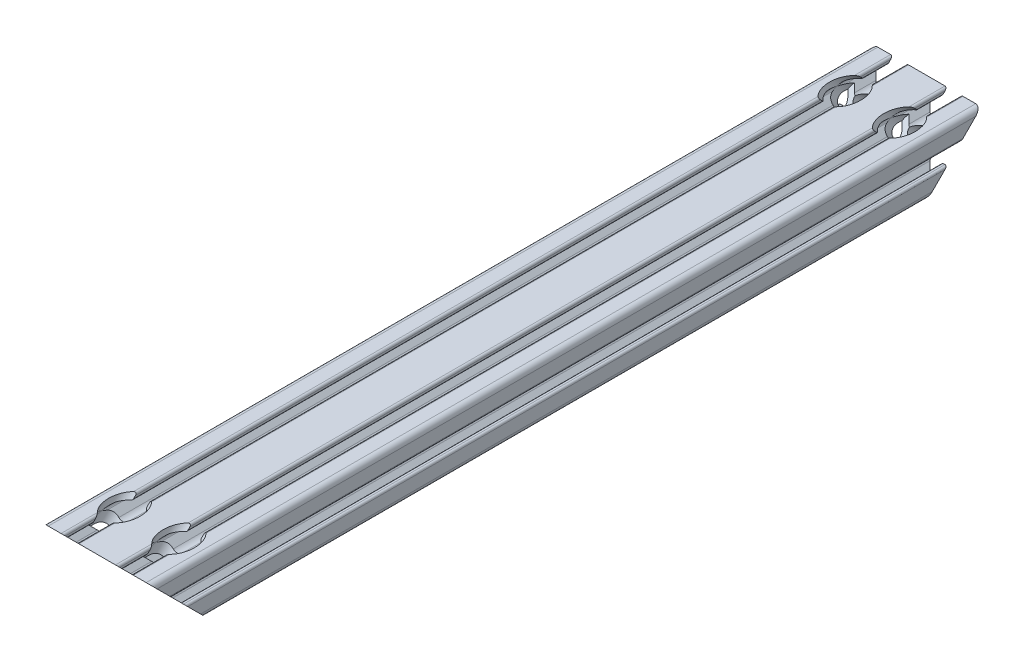
from build123d import *

# Parameters (mm, degrees)
SKETCH1_R               = 2.1463
BOSS_EXTRUDE1_DEPTH     = 152.4
CUT_EXTRUDE1_DEPTH      = 155.030029962
CUT_EXTRUDE1_DEPTH_BACK = 155.030029962


with BuildPart() as part:
    # Sketch1 → Boss-Extrude1 (new, symmetric)
    with BuildSketch(Plane.XY):
        with BuildLine():
            Line((-19.9898, 7.9883), (-19.9898, 3.2893))
            ThreePointArc((-19.9898, 3.2893), (-19.75917588, 2.73252412), (-19.2024, 2.5019))
            Line((-19.2024, 2.5019), (-18.4912, 2.5019))
            ThreePointArc((-18.4912, 2.5019), (-18.275673853, 2.591173853), (-18.1864, 2.8067))
            Line((-18.1864, 2.8067), (-18.1864, 4.9149))
            ThreePointArc((-18.1864, 4.9149), (-17.668965253, 5.689295824), (-16.755503096, 5.507596904))
            Line((-16.755503096, 5.507596904), (-14.500665747, 3.252759555))
            ThreePointArc((-14.500665747, 3.252759555), (-13.850954457, 2.280397894), (-13.622806192, 1.133419111))
            Line((-13.622806192, 1.133419111), (-13.622806192, -1.133419111))
            ThreePointArc((-13.622806192, -1.133419111), (-13.850954457, -2.280397894), (-14.500665747, -3.252759555))
            Line((-14.500665747, -3.252759555), (-16.755503096, -5.507596904))
            ThreePointArc((-16.755503096, -5.507596904), (-17.668965253, -5.689295824), (-18.1864, -4.9149))
            Line((-18.1864, -4.9149), (-18.1864, -2.8067))
            ThreePointArc((-18.1864, -2.8067), (-18.275673853, -2.591173853), (-18.4912, -2.5019))
            Line((-18.4912, -2.5019), (-19.2024, -2.5019))
            ThreePointArc((-19.2024, -2.5019), (-19.75917588, -2.73252412), (-19.9898, -3.2893))
            Line((-19.9898, -3.2893), (-19.9898, -7.9883))
            ThreePointArc((-19.9898, -7.9883), (-19.402080467, -9.407180467), (-17.9832, -9.9949))
            Line((-17.9832, -9.9949), (-13.2842, -9.9949))
            ThreePointArc((-13.2842, -9.9949), (-12.72742412, -9.76427588), (-12.4968, -9.2075))
            Line((-12.4968, -9.2075), (-12.4968, -8.4963))
            ThreePointArc((-12.4968, -8.4963), (-12.586073853, -8.280773853), (-12.8016, -8.1915))
            Line((-12.8016, -8.1915), (-14.9098, -8.1915))
            ThreePointArc((-14.9098, -8.1915), (-15.684195824, -7.674065253), (-15.502496904, -6.760603096))
            Line((-15.502496904, -6.760603096), (-13.247659555, -4.505765747))
            ThreePointArc((-13.247659555, -4.505765747), (-12.275297894, -3.856054457), (-11.128319111, -3.627906192))
            Line((-11.128319111, -3.627906192), (-8.861480889, -3.627906192))
            ThreePointArc((-8.861480889, -3.627906192), (-7.714502106, -3.856054457), (-6.742140445, -4.505765747))
            Line((-6.742140445, -4.505765747), (-4.487303096, -6.760603096))
            ThreePointArc((-4.487303096, -6.760603096), (-4.305604176, -7.674065253), (-5.08, -8.1915))
            Line((-5.08, -8.1915), (-7.1882, -8.1915))
            ThreePointArc((-7.1882, -8.1915), (-7.403726147, -8.280773853), (-7.493, -8.4963))
            Line((-7.493, -8.4963), (-7.493, -9.2075))
            ThreePointArc((-7.493, -9.2075), (-7.26237588, -9.76427588), (-6.7056, -9.9949))
            Line((-6.7056, -9.9949), (0, -9.9949))
            Line((0, -9.9949), (6.7056, -9.9949))
            ThreePointArc((6.7056, -9.9949), (7.26237588, -9.76427588), (7.493, -9.2075))
            Line((7.493, -9.2075), (7.493, -8.4963))
            ThreePointArc((7.493, -8.4963), (7.403726147, -8.280773853), (7.1882, -8.1915))
            Line((7.1882, -8.1915), (5.08, -8.1915))
            ThreePointArc((5.08, -8.1915), (4.305604176, -7.674065253), (4.487303096, -6.760603096))
            Line((4.487303096, -6.760603096), (6.742140445, -4.505765747))
            ThreePointArc((6.742140445, -4.505765747), (7.714502106, -3.856054457), (8.861480889, -3.627906192))
            Line((8.861480889, -3.627906192), (11.128319111, -3.627906192))
            ThreePointArc((11.128319111, -3.627906192), (12.275297894, -3.856054457), (13.247659555, -4.505765747))
            Line((13.247659555, -4.505765747), (15.502496904, -6.760603096))
            ThreePointArc((15.502496904, -6.760603096), (15.684195824, -7.674065253), (14.9098, -8.1915))
            Line((14.9098, -8.1915), (12.8016, -8.1915))
            ThreePointArc((12.8016, -8.1915), (12.586073853, -8.280773853), (12.4968, -8.4963))
            Line((12.4968, -8.4963), (12.4968, -9.2075))
            ThreePointArc((12.4968, -9.2075), (12.72742412, -9.76427588), (13.2842, -9.9949))
            Line((13.2842, -9.9949), (17.9832, -9.9949))
            ThreePointArc((17.9832, -9.9949), (19.402080467, -9.407180467), (19.9898, -7.9883))
            Line((19.9898, -7.9883), (19.9898, -3.2893))
            ThreePointArc((19.9898, -3.2893), (19.75917588, -2.73252412), (19.2024, -2.5019))
            Line((19.2024, -2.5019), (18.4912, -2.5019))
            ThreePointArc((18.4912, -2.5019), (18.275673853, -2.591173853), (18.1864, -2.8067))
            Line((18.1864, -2.8067), (18.1864, -4.9149))
            ThreePointArc((18.1864, -4.9149), (17.668965253, -5.689295824), (16.755503096, -5.507596904))
            Line((16.755503096, -5.507596904), (14.500665747, -3.252759555))
            ThreePointArc((14.500665747, -3.252759555), (13.850954457, -2.280397894), (13.622806192, -1.133419111))
            Line((13.622806192, -1.133419111), (13.622806192, 1.133419111))
            ThreePointArc((13.622806192, 1.133419111), (13.850954457, 2.280397894), (14.500665747, 3.252759555))
            Line((14.500665747, 3.252759555), (16.755503096, 5.507596904))
            ThreePointArc((16.755503096, 5.507596904), (17.668965253, 5.689295824), (18.1864, 4.9149))
            Line((18.1864, 4.9149), (18.1864, 2.8067))
            ThreePointArc((18.1864, 2.8067), (18.275673853, 2.591173853), (18.4912, 2.5019))
            Line((18.4912, 2.5019), (19.2024, 2.5019))
            ThreePointArc((19.2024, 2.5019), (19.75917588, 2.73252412), (19.9898, 3.2893))
            Line((19.9898, 3.2893), (19.9898, 7.9883))
            ThreePointArc((19.9898, 7.9883), (19.402080467, 9.407180467), (17.9832, 9.9949))
            Line((17.9832, 9.9949), (13.2842, 9.9949))
            ThreePointArc((13.2842, 9.9949), (12.72742412, 9.76427588), (12.4968, 9.2075))
            Line((12.4968, 9.2075), (12.4968, 8.4963))
            ThreePointArc((12.4968, 8.4963), (12.586073853, 8.280773853), (12.8016, 8.1915))
            Line((12.8016, 8.1915), (14.9098, 8.1915))
            ThreePointArc((14.9098, 8.1915), (15.684195824, 7.674065253), (15.502496904, 6.760603096))
            Line((15.502496904, 6.760603096), (13.247659555, 4.505765747))
            ThreePointArc((13.247659555, 4.505765747), (12.275297894, 3.856054457), (11.128319111, 3.627906192))
            Line((11.128319111, 3.627906192), (8.861480889, 3.627906192))
            ThreePointArc((8.861480889, 3.627906192), (7.714502106, 3.856054457), (6.742140445, 4.505765747))
            Line((6.742140445, 4.505765747), (4.487303096, 6.760603096))
            ThreePointArc((4.487303096, 6.760603096), (4.305604176, 7.674065253), (5.08, 8.1915))
            Line((5.08, 8.1915), (7.1882, 8.1915))
            ThreePointArc((7.1882, 8.1915), (7.403726147, 8.280773853), (7.493, 8.4963))
            Line((7.493, 8.4963), (7.493, 9.2075))
            ThreePointArc((7.493, 9.2075), (7.26237588, 9.76427588), (6.7056, 9.9949))
            Line((6.7056, 9.9949), (0, 9.9949))
            Line((0, 9.9949), (-6.7056, 9.9949))
            ThreePointArc((-6.7056, 9.9949), (-7.26237588, 9.76427588), (-7.493, 9.2075))
            Line((-7.493, 9.2075), (-7.493, 8.4963))
            ThreePointArc((-7.493, 8.4963), (-7.403726147, 8.280773853), (-7.1882, 8.1915))
            Line((-7.1882, 8.1915), (-5.08, 8.1915))
            ThreePointArc((-5.08, 8.1915), (-4.305604176, 7.674065253), (-4.487303096, 6.760603096))
            Line((-4.487303096, 6.760603096), (-6.742140445, 4.505765747))
            ThreePointArc((-6.742140445, 4.505765747), (-7.714502106, 3.856054457), (-8.861480889, 3.627906192))
            Line((-8.861480889, 3.627906192), (-11.128319111, 3.627906192))
            ThreePointArc((-11.128319111, 3.627906192), (-12.275297894, 3.856054457), (-13.247659555, 4.505765747))
            Line((-13.247659555, 4.505765747), (-15.502496904, 6.760603096))
            ThreePointArc((-15.502496904, 6.760603096), (-15.684195824, 7.674065253), (-14.9098, 8.1915))
            Line((-14.9098, 8.1915), (-12.8016, 8.1915))
            ThreePointArc((-12.8016, 8.1915), (-12.586073853, 8.280773853), (-12.4968, 8.4963))
            Line((-12.4968, 8.4963), (-12.4968, 9.2075))
            ThreePointArc((-12.4968, 9.2075), (-12.72742412, 9.76427588), (-13.2842, 9.9949))
            Line((-13.2842, 9.9949), (-17.9832, 9.9949))
            ThreePointArc((-17.9832, 9.9949), (-19.402080467, 9.407180467), (-19.9898, 7.9883))
        make_face()
        with Locations((-9.9949, 0)):
            Circle(SKETCH1_R, mode=Mode.SUBTRACT)
        with Locations((9.9949, 0)):
            Circle(SKETCH1_R, mode=Mode.SUBTRACT)
        with BuildLine():
            Line((-6.366993808, 1.133419111), (-6.366993808, -1.133419111))
            ThreePointArc((-6.366993808, -1.133419111), (-6.138845543, -2.280397894), (-5.489134253, -3.252759555))
            Line((-5.489134253, -3.252759555), (-0.939581002, -7.802312806))
            ThreePointArc((-0.939581002, -7.802312806), (0, -8.1915), (0.939581002, -7.802312806))
            Line((0.939581002, -7.802312806), (5.489134253, -3.252759555))
            ThreePointArc((5.489134253, -3.252759555), (6.138845543, -2.280397894), (6.366993808, -1.133419111))
            Line((6.366993808, -1.133419111), (6.366993808, 1.133419111))
            ThreePointArc((6.366993808, 1.133419111), (6.138845543, 2.280397894), (5.489134253, 3.252759555))
            Line((5.489134253, 3.252759555), (0.939581002, 7.802312806))
            ThreePointArc((0.939581002, 7.802312806), (0, 8.1915), (-0.939581002, 7.802312806))
            Line((-0.939581002, 7.802312806), (-5.489134253, 3.252759555))
            ThreePointArc((-5.489134253, 3.252759555), (-6.138845543, 2.280397894), (-6.366993808, 1.133419111))
        make_face(mode=Mode.SUBTRACT)
    extrude(amount=BOSS_EXTRUDE1_DEPTH, both=True)

    # Sketch2 → Cut-Extrude1 (cut, two sides: drawn at the far end of the back side and taken through both)
    with BuildSketch(Plane(origin=(0, 0, 0), x_dir=(0, 0, -1), z_dir=(1, 0, 0)).offset(-CUT_EXTRUDE1_DEPTH_BACK)):
        Polygon((-152.4, 9.9949), (-152.4, -9.9949), (-132.4102, -9.9949), align=None)
        Polygon((132.4102, -9.9949), (152.4, 9.9949), (152.4, -9.9949), align=None)
    extrude(amount=CUT_EXTRUDE1_DEPTH + CUT_EXTRUDE1_DEPTH_BACK, mode=Mode.SUBTRACT)

    # Sketch3 → Cut-Revolve1 (revolve, cut)
    with BuildSketch(Plane(origin=(-9.9949, 0, 0), x_dir=(0, 0, -1), z_dir=(1, 0, 0))):
        Polygon((-128.344336008, 14.060763992), (-132.4102, 18.126627984), (-142.581876695, 7.954951288), (-140.389845674, 5.762920267), (-144.27893297, 1.87383297), (-142.4051, 0), align=None)
    cut_revolve1 = revolve(axis=Axis((-9.9949, -9.9949, 152.4), (0, 0.7071067811865476, -0.7071067811865476)), mode=Mode.SUBTRACT)

    # Mirror1: Cut-Revolve1 across plane
    add(cut_revolve1.mirror(Plane.XY), mode=Mode.SUBTRACT)

    # Mirror2: Cut-Revolve1 across plane
    add(cut_revolve1.mirror(Plane(origin=(0, 0, 0), x_dir=(0, 0, 1), z_dir=(1, 0, 0))), mode=Mode.SUBTRACT)

    # Mirror2 copy 1 sketch → Mirror2 copy 1 (revolve, cut)
    with BuildSketch(Plane.ZY.offset(-9.9949)):
        Polygon((-128.344336008, 14.060763992), (-132.4102, 18.126627984), (-142.581876695, 7.954951288), (-140.389845674, 5.762920267), (-144.27893297, 1.87383297), (-142.4051, 0), align=None)
    revolve(axis=Axis((9.9949, -9.9949, -152.4), (0, 0.7071067811865476, 0.7071067811865476)), mode=Mode.SUBTRACT)


solid = part.part
